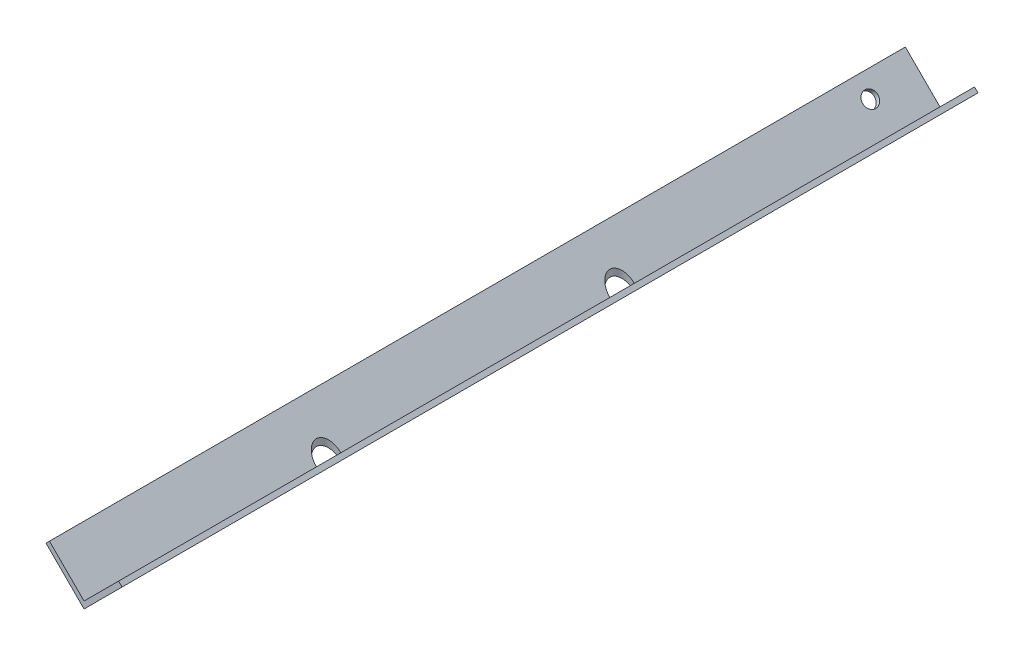
from build123d import *

# Parameters (mm, degrees)
BOSS_EXTRUDE1_DEPTH     = 222.25
SKETCH2_R               = 1.984375
CUT_EXTRUDE1_DEPTH      = 223.650596114
SKETCH3_R               = 1.984375
CUT_EXTRUDE2_DEPTH      = 223.650596114
CUT_EXTRUDE4_DEPTH      = 223.650596114
CUT_EXTRUDE4_DEPTH_BACK = 223.650596114
SKETCH4_R               = 3.175


with BuildPart() as part:
    # Sketch1 → Boss-Extrude1 (new body)
    with BuildSketch(Plane.XY):
        Polygon((0, 0), (-8.980256121, 8.980256121), (-9.878281733, 8.082230509), (0, -1.796051224), (9.878281733, 8.082230509), (8.980256121, 8.980256121), align=None)
    extrude(amount=BOSS_EXTRUDE1_DEPTH)

    # Sketch2 → Cut-Extrude1 (cut, through all)
    with BuildSketch(Plane(origin=(0, 0, 0), x_dir=(0, 0, 1), z_dir=(-0.7071067811865471, 0.7071067811865479, 0))):
        with Locations((6.35, 7.62)):
            Circle(SKETCH2_R)
        with Locations((19.05, 7.62)):
            Circle(SKETCH2_R)
    extrude(amount=-CUT_EXTRUDE1_DEPTH, mode=Mode.SUBTRACT)

    # Sketch3 → Cut-Extrude2 (cut, through all)
    with BuildSketch(Plane(origin=(0, 0, 0), x_dir=(0, 0, -1), z_dir=(0.7071067811865482, 0.7071067811865468, 0))):
        with Locations((-12.7, 7.62)):
            Circle(SKETCH3_R)
    extrude(amount=-CUT_EXTRUDE2_DEPTH, mode=Mode.SUBTRACT)

    # Sketch4 → Cut-Extrude4 (cut, two sides: drawn at the far end of the back side and taken through both)
    with BuildSketch(Plane(origin=(0, 0, 0), x_dir=(1, 0, 0), z_dir=(0, 1, 0)).offset(-CUT_EXTRUDE4_DEPTH_BACK)):
        with Locations((0, -158.75)):
            Circle(SKETCH4_R)
        with Locations((0, -82.55)):
            Circle(SKETCH4_R)
    extrude(amount=CUT_EXTRUDE4_DEPTH + CUT_EXTRUDE4_DEPTH_BACK, mode=Mode.SUBTRACT)


solid = part.part
